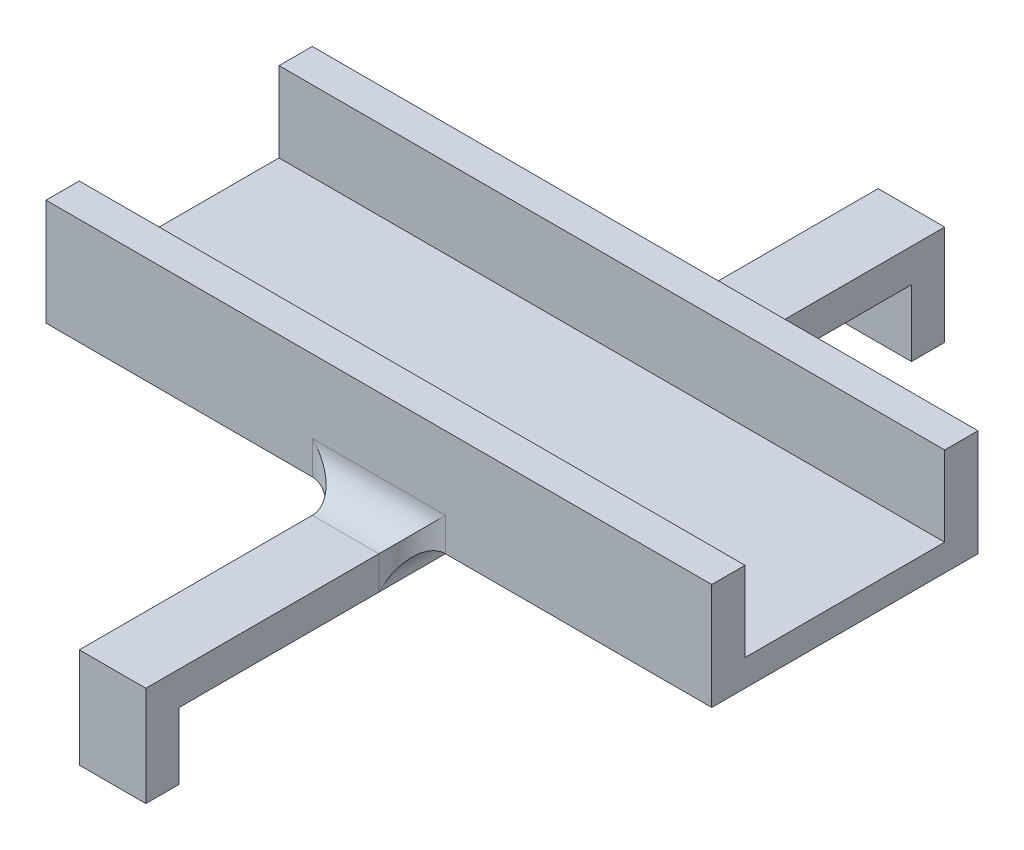
from build123d import *

# Parameters (mm, degrees)
SKETCH1_W           = 100
SKETCH1_H           = 40
BOSS_EXTRUDE2_DEPTH = 16
SKETCH3_W           = 100
SKETCH3_H           = 30
CUT_EXTRUDE1_DEPTH  = 12
SKETCH4_W           = 10
SKETCH4_H           = 120
BOSS_EXTRUDE3_DEPTH = 5
SKETCH5_W           = 10
SKETCH5_H           = 5
BOSS_EXTRUDE4_DEPTH = 10
SKETCH6_W           = 10
SKETCH6_H           = 5
BOSS_EXTRUDE5_DEPTH = 10
FILLET1_R           = 5
FILLET2_R           = 5
FILLET3_R           = 5


with BuildPart() as part:
    # Sketch1 → Boss-Extrude2 (new body)
    with BuildSketch(Plane(origin=(0, 0, 0), x_dir=(1, 0, 0), z_dir=(0, 1, 0))):
        Rectangle(SKETCH1_W, SKETCH1_H)
    extrude(amount=BOSS_EXTRUDE2_DEPTH)

    # Sketch3 → Cut-Extrude1 (cut)
    with BuildSketch(Plane(origin=(0, 16, 0), x_dir=(1, 0, 0), z_dir=(0, 1, 0))):
        Rectangle(SKETCH3_W, SKETCH3_H)
    extrude(amount=-CUT_EXTRUDE1_DEPTH, mode=Mode.SUBTRACT)

    # Sketch4 → Boss-Extrude3 (add)
    with BuildSketch(Plane(origin=(0, 0, 0), x_dir=(-1, 0, 0), z_dir=(0, -1, 0))):
        Rectangle(SKETCH4_W, SKETCH4_H)
    extrude(amount=BOSS_EXTRUDE3_DEPTH)

    # Sketch5 → Boss-Extrude4 (add)
    with BuildSketch(Plane.XZ.offset(5)):
        with Locations((0, 57.5)):
            Rectangle(SKETCH5_W, SKETCH5_H)
    extrude(amount=BOSS_EXTRUDE4_DEPTH)

    # Sketch6 → Boss-Extrude5 (add)
    with BuildSketch(Plane.XZ.offset(5)):
        with Locations((0, -57.5)):
            Rectangle(SKETCH6_W, SKETCH6_H)
    extrude(amount=BOSS_EXTRUDE5_DEPTH)

    # Fillet1
    fillet1_edges = [part.edges().sort_by_distance(p)[0] for p in [
        (5, 0, 0),
    ]]
    fillet(fillet1_edges, radius=FILLET1_R - 0.0001)  # a hair under: the kernel refuses the full size

    # Fillet2
    fillet2_edges = [part.edges().sort_by_distance(p)[0] for p in [
        (-5, 0, 0),
    ]]
    fillet(fillet2_edges, radius=FILLET2_R - 0.0001)  # a hair under: the kernel refuses the full size

    # Fillet3
    fillet3_edges = [part.edges().sort_by_distance(p)[0] for p in [
        (0, 0, 20),
        (0, 0, -20),
        (-5, -2.49995, -20),
        (-5, -2.49995, 20),
        (5, -2.49995, 20),
        (5, -2.49995, -20),
    ]]
    fillet(fillet3_edges, radius=FILLET3_R - 0.0004)  # a hair under: the kernel refuses the full size


solid = part.part
